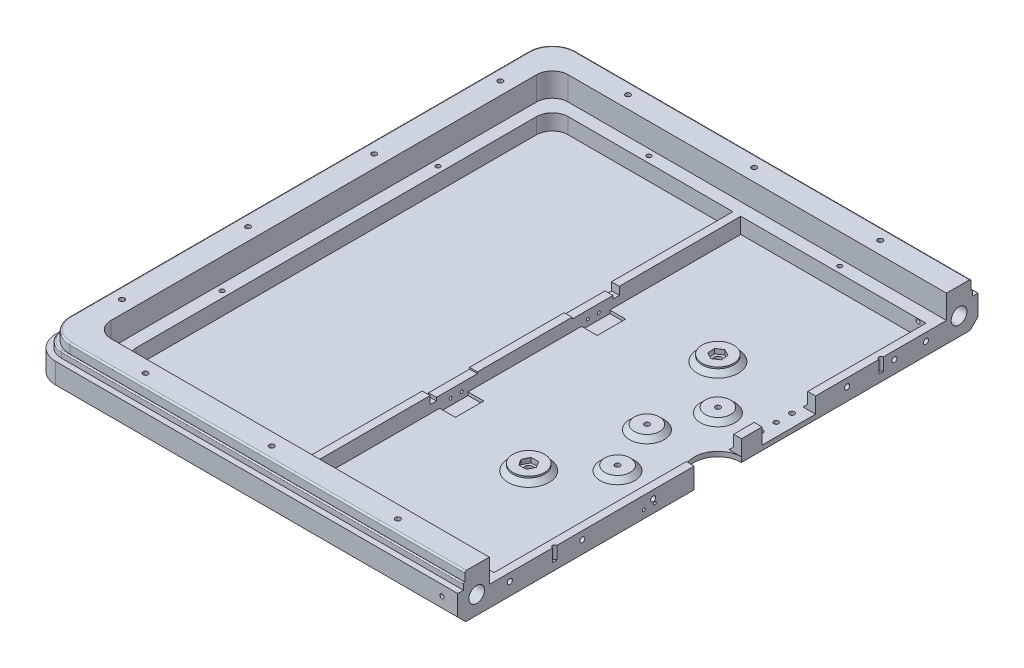
from build123d import *

# Parameters (mm, degrees)
SKETCH1_W                       = 540
SKETCH1_H                       = 330
BOSS_EXTRUDE1_DEPTH             = 3
SKETCH2_W                       = 540
SKETCH2_H                       = 330
SKETCH2_W_2                     = 500
SKETCH2_H_2                     = 290
BOSS_EXTRUDE2_DEPTH             = 25
FILLET1_R                       = 15
SKETCH4_R                       = 1.6
CUT_EXTRUDE1_DEPTH              = 28
SKETCH5_R                       = 15
CUT_EXTRUDE2_DEPTH              = 3
CHAMFER1_SIZE                   = 5
SKETCH7_R                       = 2.6
CUT_EXTRUDE3_DEPTH              = 3
SKETCH9_R                       = 1.6
CUT_EXTRUDE4_DEPTH              = 47
CUT_EXTRUDE5_DEPTH              = 10
FILLET2_R                       = 1
BOSS_EXTRUDE3_DEPTH             = 4
FILLET4_R                       = 0.8
SKETCH23_W                      = 10
SKETCH23_H                      = 130
SKETCH23_W_2                    = 5
SKETCH23_H_2                    = 290
BOSS_EXTRUDE4_DEPTH             = 10
SKETCH24_W                      = 500
SKETCH24_H                      = 290
SKETCH24_W_2                    = 484
SKETCH24_H_2                    = 274
BOSS_EXTRUDE5_DEPTH             = 10
CUT_EXTRUDE6_REACH              = 433.295
SKETCH25_R                      = 0.9
SKETCH26_W                      = 10
SKETCH26_H                      = 18
CUT_EXTRUDE7_DEPTH              = 2
SKETCH27_W                      = 5
SKETCH27_H                      = 30
CUT_EXTRUDE8_DEPTH              = 3
SKETCH28_W                      = 5
SKETCH28_H                      = 60
CUT_EXTRUDE9_DEPTH              = 2
SKETCH29_W                      = 5
SKETCH29_H                      = 4
CUT_EXTRUDE10_DEPTH             = 2
SKETCH31_W                      = 16
SKETCH31_H                      = 34
BOSS_EXTRUDE6_DEPTH             = 53
BOSS_EXTRUDE6_DIRECTION_2_REACH = 318.781
FILLET5_R                       = 15
SKETCH34_R                      = 3
CUT_EXTRUDE11_DEPTH             = 53
SKETCH35_R                      = 8
SKETCH35_R_2                    = 1.6
BOSS_EXTRUDE7_DEPTH             = 3
CHAMFER2_SIZE                   = 3
SKETCH37_W                      = 16
SKETCH37_H                      = 34
CUT_EXTRUDE12_DEPTH             = 63
SKETCH38_R                      = 1.6
SKETCH38_R_2                    = 1.5
CUT_EXTRUDE13_DEPTH             = 90
CHAMFER3_SIZE                   = 3
SKETCH39_R                      = 1.4
CUT_EXTRUDE14_DEPTH             = 8
FILLET6_R                       = 10
FILLET7_R                       = 10
CUT_EXTRUDE15_DEPTH             = 30
CUT_EXTRUDE15_DEPTH_BACK        = 30
SKETCH41_R                      = 5
CUT_EXTRUDE16_DEPTH             = 10
CUT_EXTRUDE16_DEPTH_BACK        = 30
SKETCH42_R                      = 1.6
CUT_EXTRUDE17_DEPTH             = 17
CUT_EXTRUDE17_DEPTH_BACK        = 2
SKETCH45_R                      = 10
SKETCH45_R_2                    = 2.6
BOSS_EXTRUDE8_DEPTH             = 4
CHAMFER4_SIZE                   = 3
CUT_EXTRUDE18_DEPTH             = 3
CUT_EXTRUDE20_REACH             = 429.298
SKETCH52_R                      = 1.35
CUT_EXTRUDE21_REACH             = 319.662
SKETCH51_W                      = 369.751522886
SKETCH51_H                      = 368.591490559


# Some blends are built 0.0001 mm under size
with BuildPart() as part:
    # Sketch1 → Boss-Extrude1 (new body)
    with BuildSketch(Plane(origin=(0, 0, 0), x_dir=(1, 0, 0), z_dir=(0, 1, 0))):
        Rectangle(SKETCH1_W, SKETCH1_H)
    extrude(amount=BOSS_EXTRUDE1_DEPTH)

    # Sketch2 → Boss-Extrude2 (add)
    with BuildSketch(Plane(origin=(0, 3, 0), x_dir=(1, 0, 0), z_dir=(0, 1, 0))):
        Rectangle(SKETCH2_W, SKETCH2_H)
        Rectangle(SKETCH2_W_2, SKETCH2_H_2, mode=Mode.SUBTRACT)
    extrude(amount=BOSS_EXTRUDE2_DEPTH)

    # Fillet1
    fillet1_edges = [part.edges().sort_by_distance(p)[0] for p in [
        (270, 14, 165),
        (-270, 14, 165),
        (-270, 14, -165),
        (270, 14, -165),
    ]]
    fillet(fillet1_edges, radius=FILLET1_R)

    # Sketch4 → Cut-Extrude1 (cut)
    with BuildSketch(Plane(origin=(0, 28, 0), x_dir=(1, 0, 0), z_dir=(0, 1, 0))):
        with Locations(Location((-258, 120, 0), (0, 0, 270))):
            Circle(SKETCH4_R)
        with Locations(Location((-258, 40, 0), (0, 0, 270))):
            Circle(SKETCH4_R)
        with Locations(Location((-210, 153, 0), (0, 0, 270))):
            Circle(SKETCH4_R)
        with Locations(Location((-130, 153, 0), (0, 0, 270))):
            Circle(SKETCH4_R)
        with Locations(Location((-50, 153, 0), (0, 0, 270))):
            Circle(SKETCH4_R)
        with Locations(Location((50, 153, 0), (0, 0, 90))):
            Circle(SKETCH4_R)
        with Locations(Location((130, 153, 0), (0, 0, 90))):
            Circle(SKETCH4_R)
        with Locations(Location((210, 153, 0), (0, 0, 90))):
            Circle(SKETCH4_R)
        with Locations(Location((258, 40, 0), (0, 0, 90))):
            Circle(SKETCH4_R)
        with Locations(Location((258, 120, 0), (0, 0, 90))):
            Circle(SKETCH4_R)
        with Locations(Location((258, -120, 0), (0, 0, 270))):
            Circle(SKETCH4_R)
        with Locations(Location((258, -40, 0), (0, 0, 270))):
            Circle(SKETCH4_R)
        with Locations(Location((210, -153, 0), (0, 0, 270))):
            Circle(SKETCH4_R)
        with Locations(Location((130, -153, 0), (0, 0, 270))):
            Circle(SKETCH4_R)
        with Locations(Location((50, -153, 0), (0, 0, 270))):
            Circle(SKETCH4_R)
        with Locations(Location((-50, -153, 0), (0, 0, 90))):
            Circle(SKETCH4_R)
        with Locations(Location((-130, -153, 0), (0, 0, 90))):
            Circle(SKETCH4_R)
        with Locations(Location((-210, -153, 0), (0, 0, 90))):
            Circle(SKETCH4_R)
        with Locations(Location((-258, -40, 0), (0, 0, 90))):
            Circle(SKETCH4_R)
        with Locations(Location((-258, -120, 0), (0, 0, 90))):
            Circle(SKETCH4_R)
    extrude(amount=-CUT_EXTRUDE1_DEPTH, mode=Mode.SUBTRACT)

    # Sketch5 → Cut-Extrude2 (cut)
    with BuildSketch(Plane(origin=(0, 3, 0), x_dir=(1, 0, 0), z_dir=(0, 1, 0))):
        with Locations(Location((0, 0, 0), (0, 0, 270))):
            Circle(SKETCH5_R)
    extrude(amount=-CUT_EXTRUDE2_DEPTH, mode=Mode.SUBTRACT)

    # Chamfer1
    chamfer1_edges = [part.edges().sort_by_distance(p)[0] for p in [
        (-270, 0, 0),
        (270, 0, 0),
        (0, 0, 165),
        (0, 0, -165),
        (265.606601718, 0, -160.606601718),
        (265.606601718, 0, 160.606601718),
        (-265.606601718, 0, 160.606601718),
        (-265.606601718, 0, -160.606601718),
    ]]
    chamfer(chamfer1_edges, length=CHAMFER1_SIZE)

    # Sketch7 → Cut-Extrude3 (cut)
    with BuildSketch(Plane.XZ):
        with Locations(Location((-60, 60, 0), (0, 0, 270))):
            Circle(SKETCH7_R)
        with Locations(Location((60, 60, 0), (0, 0, 270))):
            Circle(SKETCH7_R)
        with Locations(Location((60, -60, 0), (0, 0, 270))):
            Circle(SKETCH7_R)
        with Locations(Location((-60, -60, 0), (0, 0, 270))):
            Circle(SKETCH7_R)
    extrude(amount=-CUT_EXTRUDE3_DEPTH, mode=Mode.SUBTRACT)

    # Sketch9 → Cut-Extrude4 (cut)
    with BuildSketch(Plane.XZ):
        with Locations(Location((-31.819805153, 31.819805153, 0), (0, 0, 270))):
            Circle(SKETCH9_R)
        with Locations(Location((31.819805153, 31.819805153, 0), (0, 0, 270))):
            Circle(SKETCH9_R)
        with Locations(Location((31.819805153, -31.819805153, 0), (0, 0, 270))):
            Circle(SKETCH9_R)
        with Locations(Location((-31.819805153, -31.819805153, 0), (0, 0, 270))):
            Circle(SKETCH9_R)
        with Locations(Location((45, 0, 0), (0, 0, 270))):
            Circle(SKETCH9_R)
        with Locations(Location((-45, 0, 0), (0, 0, 270))):
            Circle(SKETCH9_R)
    extrude(amount=-CUT_EXTRUDE4_DEPTH, mode=Mode.SUBTRACT)

    # Sketch19 → Cut-Extrude5 (cut)
    with BuildSketch(Plane(origin=(0, 28, 0), x_dir=(1, 0, 0), z_dir=(0, 1, 0))):
        with BuildLine():
            Line((255, -165), (-255, -165))
            ThreePointArc((-255, -165), (-265.606601718, -160.606601718), (-270, -150))
            Line((-270, -150), (-270, 150))
            ThreePointArc((-270, 150), (-265.606601718, 160.606601718), (-255, 165))
            Line((-255, 165), (255, 165))
            ThreePointArc((255, 165), (265.606601718, 160.606601718), (270, 150))
            Line((270, 150), (270, -150))
            ThreePointArc((270, -150), (265.606601718, -160.606601718), (255, -165))
        make_face()
        with BuildLine():
            Line((250.5, 160.5), (-250.5, 160.5))
            ThreePointArc((-250.5, 160.5), (-261.106601718, 156.106601718), (-265.5, 145.5))
            Line((-265.5, 145.5), (-265.5, -145.5))
            ThreePointArc((-265.5, -145.5), (-261.106601718, -156.106601718), (-250.5, -160.5))
            Line((-250.5, -160.5), (250.5, -160.5))
            ThreePointArc((250.5, -160.5), (261.106601718, -156.106601718), (265.5, -145.5))
            Line((265.5, -145.5), (265.5, 145.5))
            ThreePointArc((265.5, 145.5), (261.106601718, 156.106601718), (250.5, 160.5))
        make_face(mode=Mode.SUBTRACT)
    extrude(amount=-CUT_EXTRUDE5_DEPTH, mode=Mode.SUBTRACT)

    # Fillet2
    fillet2_edges = [part.edges().sort_by_distance(p)[0] for p in [
        (-261.106601718, 28, -156.106601718),
        (0, 28, -160.5),
        (261.106601718, 28, -156.106601718),
        (265.5, 28, 0),
        (261.106601718, 28, 156.106601718),
        (0, 28, 160.5),
        (-261.106601718, 28, 156.106601718),
        (-265.5, 28, 0),
    ]]
    fillet(fillet2_edges, radius=FILLET2_R)

    # Sketch20 → Boss-Extrude3 (add)
    with BuildSketch(Plane(origin=(0, 18, 0), x_dir=(1, 0, 0), z_dir=(0, 1, 0))):
        with BuildLine():
            Line((-255, 161.4), (255, 161.4))
            ThreePointArc((255, 161.4), (263.061017306, 158.061017306), (266.4, 150))
            Line((266.4, 150), (266.4, -150))
            ThreePointArc((266.4, -150), (263.061017306, -158.061017306), (255, -161.4))
            Line((255, -161.4), (-255, -161.4))
            ThreePointArc((-255, -161.4), (-263.061017306, -158.061017306), (-266.4, -150))
            Line((-266.4, -150), (-266.4, 150))
            ThreePointArc((-266.4, 150), (-263.061017306, 158.061017306), (-255, 161.4))
        make_face()
        with BuildLine():
            Line((-255, 157.9), (255, 157.9))
            ThreePointArc((255, 157.9), (260.586143571, 155.586143571), (262.9, 150))
            Line((262.9, 150), (262.9, -150))
            ThreePointArc((262.9, -150), (260.586143571, -155.586143571), (255, -157.9))
            Line((255, -157.9), (-255, -157.9))
            ThreePointArc((-255, -157.9), (-260.586143571, -155.586143571), (-262.9, -150))
            Line((-262.9, -150), (-262.9, 150))
            ThreePointArc((-262.9, 150), (-260.586143571, 155.586143571), (-255, 157.9))
        make_face(mode=Mode.SUBTRACT)
    extrude(amount=BOSS_EXTRUDE3_DEPTH)

    # Fillet4
    fillet4_edges = [part.edges().sort_by_distance(p)[0] for p in [
        (-263.061017306, 22, -158.061017306),
        (-266.4, 22, 0),
        (-263.061017306, 22, 158.061017306),
        (0, 22, 161.4),
        (263.061017306, 22, 158.061017306),
        (266.4, 22, 0),
        (263.061017306, 22, -158.061017306),
        (0, 22, -161.4),
    ]]
    fillet(fillet4_edges, radius=FILLET4_R)

    # Sketch23 → Boss-Extrude4 (add)
    with BuildSketch(Plane(origin=(0, 3, 0), x_dir=(1, 0, 0), z_dir=(0, 1, 0))):
        with Locations((0, 80)):
            Rectangle(SKETCH23_W, SKETCH23_H)
        with Locations((0, -80)):
            Rectangle(SKETCH23_W, SKETCH23_H)
        with Locations((125, 0)):
            Rectangle(SKETCH23_W_2, SKETCH23_H_2)
        with Locations((-125, 0)):
            Rectangle(SKETCH23_W_2, SKETCH23_H_2)
    extrude(amount=BOSS_EXTRUDE4_DEPTH)

    # Sketch24 → Boss-Extrude5 (add)
    with BuildSketch(Plane(origin=(0, 3, 0), x_dir=(1, 0, 0), z_dir=(0, 1, 0))):
        Rectangle(SKETCH24_W, SKETCH24_H)
        Rectangle(SKETCH24_W_2, SKETCH24_H_2, mode=Mode.SUBTRACT)
    extrude(amount=BOSS_EXTRUDE5_DEPTH)

    # Cut-Extrude6: up to this face of the body (flat: up to its plane)
    cut_extrude6_end = Plane(part.part.faces().sort_by_distance((-127.5, 8, 0))[0])
    # Sketch25 → Cut-Extrude6 (cut, up to the picked face)
    with BuildSketch(Plane(origin=(127.5, 0, 0), x_dir=(0, 0, -1), z_dir=(1, 0, 0)), mode=Mode.PRIVATE) as cut_extrude6_sk1:
        with Locations(Location((-47, 5, 0), (0, 0, 180))):
            Circle(SKETCH25_R)
    cut_extrude6_tool1 = split(extrude(cut_extrude6_sk1.sketch, amount=-CUT_EXTRUDE6_REACH, mode=Mode.PRIVATE), bisect_by=cut_extrude6_end, keep=Keep.BOTH, mode=Mode.PRIVATE)
    # Sketch25 → Cut-Extrude6 (cut, up to the picked face)
    with BuildSketch(Plane(origin=(127.5, 0, 0), x_dir=(0, 0, -1), z_dir=(1, 0, 0)), mode=Mode.PRIVATE) as cut_extrude6_sk2:
        with Locations(Location((-40, 5, 0), (0, 0, 180))):
            Circle(SKETCH25_R)
    cut_extrude6_tool2 = split(extrude(cut_extrude6_sk2.sketch, amount=-CUT_EXTRUDE6_REACH, mode=Mode.PRIVATE), bisect_by=cut_extrude6_end, keep=Keep.BOTH, mode=Mode.PRIVATE)
    # Sketch25 → Cut-Extrude6 (cut, up to the picked face)
    with BuildSketch(Plane(origin=(127.5, 0, 0), x_dir=(0, 0, -1), z_dir=(1, 0, 0)), mode=Mode.PRIVATE) as cut_extrude6_sk3:
        with Locations(Location((47, 5, 0), (0, 0, 180))):
            Circle(SKETCH25_R)
    cut_extrude6_tool3 = split(extrude(cut_extrude6_sk3.sketch, amount=-CUT_EXTRUDE6_REACH, mode=Mode.PRIVATE), bisect_by=cut_extrude6_end, keep=Keep.BOTH, mode=Mode.PRIVATE)
    # Sketch25 → Cut-Extrude6 (cut, up to the picked face)
    with BuildSketch(Plane(origin=(127.5, 0, 0), x_dir=(0, 0, -1), z_dir=(1, 0, 0)), mode=Mode.PRIVATE) as cut_extrude6_sk4:
        with Locations(Location((40, 5, 0), (0, 0, 180))):
            Circle(SKETCH25_R)
    cut_extrude6_tool4 = split(extrude(cut_extrude6_sk4.sketch, amount=-CUT_EXTRUDE6_REACH, mode=Mode.PRIVATE), bisect_by=cut_extrude6_end, keep=Keep.BOTH, mode=Mode.PRIVATE)
    add(cut_extrude6_tool1.solids().sort_by(Axis((127.5, 5, 47), (-1, 0, 0)))[0], mode=Mode.SUBTRACT)
    add(cut_extrude6_tool2.solids().sort_by(Axis((127.5, 5, 40), (-1, 0, 0)))[0], mode=Mode.SUBTRACT)
    add(cut_extrude6_tool3.solids().sort_by(Axis((127.5, 5, -47), (-1, 0, 0)))[0], mode=Mode.SUBTRACT)
    add(cut_extrude6_tool4.solids().sort_by(Axis((127.5, 5, -40), (-1, 0, 0)))[0], mode=Mode.SUBTRACT)

    # Sketch26 → Cut-Extrude7 (cut)
    with BuildSketch(Plane(origin=(0, 3, 0), x_dir=(1, 0, 0), z_dir=(0, 1, 0))):
        with Locations((-117.5, -45)):
            Rectangle(SKETCH26_W, SKETCH26_H)
        with Locations((-117.5, 45)):
            Rectangle(SKETCH26_W, SKETCH26_H)
        with Locations((117.5, -45)):
            Rectangle(SKETCH26_W, SKETCH26_H)
        with Locations((117.5, 45)):
            Rectangle(SKETCH26_W, SKETCH26_H)
    extrude(amount=-CUT_EXTRUDE7_DEPTH, mode=Mode.SUBTRACT)

    # Sketch27 → Cut-Extrude8 (cut)
    with BuildSketch(Plane(origin=(0, 13, 0), x_dir=(1, 0, 0), z_dir=(0, 1, 0))):
        with Locations((-125, -45)):
            Rectangle(SKETCH27_W, SKETCH27_H)
        with Locations((-125, 45)):
            Rectangle(SKETCH27_W, SKETCH27_H)
        with Locations((125, 45)):
            Rectangle(SKETCH27_W, SKETCH27_H)
        with Locations((125, -45)):
            Rectangle(SKETCH27_W, SKETCH27_H)
    extrude(amount=-CUT_EXTRUDE8_DEPTH, mode=Mode.SUBTRACT)

    # Sketch28 → Cut-Extrude9 (cut)
    with BuildSketch(Plane(origin=(0, 13, 0), x_dir=(1, 0, 0), z_dir=(0, 1, 0))):
        with Locations((-125, 0)):
            Rectangle(SKETCH28_W, SKETCH28_H)
        with Locations((125, 0)):
            Rectangle(SKETCH28_W, SKETCH28_H)
    extrude(amount=-CUT_EXTRUDE9_DEPTH, mode=Mode.SUBTRACT)

    # Sketch29 → Cut-Extrude10 (cut)
    with BuildSketch(Plane(origin=(0, 10, 0), x_dir=(1, 0, 0), z_dir=(0, 1, 0))):
        with Locations((-125, 58)):
            Rectangle(SKETCH29_W, SKETCH29_H)
        with Locations((-125, -58)):
            Rectangle(SKETCH29_W, SKETCH29_H)
        with Locations((125, -58)):
            Rectangle(SKETCH29_W, SKETCH29_H)
        with Locations((125, 58)):
            Rectangle(SKETCH29_W, SKETCH29_H)
    extrude(amount=-CUT_EXTRUDE10_DEPTH, mode=Mode.SUBTRACT)

    # Sketch31 → Boss-Extrude6 (add)
    with BuildSketch(Plane(origin=(0, 13, 0), x_dir=(1, 0, 0), z_dir=(0, 1, 0))):
        with Locations((0, 45)):
            Rectangle(SKETCH31_W, SKETCH31_H)
    extrude(amount=BOSS_EXTRUDE6_DEPTH)

    # Boss-Extrude6 direction 2: up to this face of the body (flat: up to its plane)
    boss_extrude6_direction_2_end = Plane(part.part.faces().sort_by_distance((-63.514526325, 3, 0))[0])
    # Sketch31 → Boss-Extrude6 direction 2 (add, up to the picked face)
    with BuildSketch(Plane(origin=(0, 13, 0), x_dir=(1, 0, 0), z_dir=(0, 1, 0)), mode=Mode.PRIVATE) as boss_extrude6_direction_2_sk1:
        with Locations((0, 45)):
            Rectangle(SKETCH31_W, SKETCH31_H)
    boss_extrude6_direction_2_tool1 = split(extrude(boss_extrude6_direction_2_sk1.sketch, amount=-BOSS_EXTRUDE6_DIRECTION_2_REACH, mode=Mode.PRIVATE), bisect_by=boss_extrude6_direction_2_end, keep=Keep.BOTH, mode=Mode.PRIVATE)
    add(boss_extrude6_direction_2_tool1.solids().sort_by(Axis((0, 13, -45), (0, -1, 0)))[0])

    # Fillet5
    fillet5_edges = [part.edges().sort_by_distance(p)[0] for p in [
        (0, 66, -62),
        (0, 66, -28),
    ]]
    fillet(fillet5_edges, radius=FILLET5_R)

    # Sketch34 → Cut-Extrude11 (cut)
    with BuildSketch(Plane.ZY.offset(8)):
        with Locations((-45, 53)):
            Circle(SKETCH34_R)
    extrude(amount=-CUT_EXTRUDE11_DEPTH, mode=Mode.SUBTRACT)

    # Sketch35 → Boss-Extrude7 (add)
    # profile 1 of 6: a face of its own
    with BuildSketch(Plane(origin=(0, 3, 0), x_dir=(1, 0, 0), z_dir=(0, 1, 0))):
        with Locations(Location((-31.819805153, 31.819805153, 0), (0, 0, 90))):
            Circle(SKETCH35_R)
        with Locations(Location((-31.819805153, 31.819805153, 0), (0, 0, 90))):
            Circle(SKETCH35_R_2, mode=Mode.SUBTRACT)
    # profile 2 of 6: a face of its own
    with BuildSketch(Plane(origin=(0, 3, 0), x_dir=(1, 0, 0), z_dir=(0, 1, 0))):
        with Locations(Location((31.819805153, 31.819805153, 0), (0, 0, 90))):
            Circle(SKETCH35_R)
        with Locations(Location((31.819805153, 31.819805153, 0), (0, 0, 90))):
            Circle(SKETCH35_R_2, mode=Mode.SUBTRACT)
    # profile 3 of 6: a face of its own
    with BuildSketch(Plane(origin=(0, 3, 0), x_dir=(1, 0, 0), z_dir=(0, 1, 0))):
        with Locations(Location((31.819805153, -31.819805153, 0), (0, 0, 90))):
            Circle(SKETCH35_R)
        with Locations(Location((31.819805153, -31.819805153, 0), (0, 0, 90))):
            Circle(SKETCH35_R_2, mode=Mode.SUBTRACT)
    # profile 4 of 6: a face of its own
    with BuildSketch(Plane(origin=(0, 3, 0), x_dir=(1, 0, 0), z_dir=(0, 1, 0))):
        with Locations(Location((-31.819805153, -31.819805153, 0), (0, 0, 90))):
            Circle(SKETCH35_R)
        with Locations(Location((-31.819805153, -31.819805153, 0), (0, 0, 90))):
            Circle(SKETCH35_R_2, mode=Mode.SUBTRACT)
    # profile 5 of 6: a face of its own
    with BuildSketch(Plane(origin=(0, 3, 0), x_dir=(1, 0, 0), z_dir=(0, 1, 0))):
        with Locations(Location((-45, 0, 0), (0, 0, 90))):
            Circle(SKETCH35_R)
        with Locations(Location((-45, 0, 0), (0, 0, 270))):
            Circle(SKETCH35_R_2, mode=Mode.SUBTRACT)
    # profile 6 of 6: a face of its own
    with BuildSketch(Plane(origin=(0, 3, 0), x_dir=(1, 0, 0), z_dir=(0, 1, 0))):
        with Locations(Location((45, 0, 0), (0, 0, 90))):
            Circle(SKETCH35_R)
        with Locations(Location((45, 0, 0), (0, 0, 90))):
            Circle(SKETCH35_R_2, mode=Mode.SUBTRACT)
    extrude(amount=BOSS_EXTRUDE7_DEPTH)

    # Chamfer2
    chamfer2_edges = [part.edges().sort_by_distance(p)[0] for p in [
        (-31.819805153, 3, -23.819805153),
        (-45, 3, 8),
        (31.819805153, 3, -23.819805153),
        (31.819805153, 3, 39.819805153),
        (-31.819805153, 3, 39.819805153),
        (45, 3, 8),
    ]]
    chamfer(chamfer2_edges, length=CHAMFER2_SIZE - 0.0001)  # a hair under: the kernel refuses the full size

    # Sketch37 → Cut-Extrude12 (cut)
    with BuildSketch(Plane(origin=(0, 66, 0), x_dir=(1, 0, 0), z_dir=(0, 1, 0))):
        with Locations((0, 45)):
            Rectangle(SKETCH37_W, SKETCH37_H)
    extrude(amount=-CUT_EXTRUDE12_DEPTH, mode=Mode.SUBTRACT)

    # Sketch38 → Cut-Extrude13 (cut)
    with BuildSketch(Plane(origin=(0, 3, 0), x_dir=(1, 0, 0), z_dir=(0, 1, 0))):
        with Locations(Location((8, 55, 0), (0, 0, 270))):
            Circle(SKETCH38_R)
        with Locations(Location((8, 35, 0), (0, 0, 270))):
            Circle(SKETCH38_R)
        with Locations(Location((-8, 35, 0), (0, 0, 270))):
            Circle(SKETCH38_R)
        with Locations(Location((-8, 55, 0), (0, 0, 270))):
            Circle(SKETCH38_R)
        with Locations(Location((8, 45, 0), (0, 0, 270))):
            Circle(SKETCH38_R_2)
        with Locations(Location((-8, 45, 0), (0, 0, 270))):
            Circle(SKETCH38_R_2)
    extrude(amount=-CUT_EXTRUDE13_DEPTH, mode=Mode.SUBTRACT)

    # Chamfer3
    # the kernel refuses this chamfer: 3 mm, written as the material it adds along each edge
    with BuildSketch(Plane(origin=(5, 3, -15), x_dir=(0.9996219169112969, -0.027495876610586348, 0), z_dir=(0, 0, -1)), Plane(origin=(-5, 3, -28), x_dir=(-0.9996219169112968, -0.027495876610586358, 0), z_dir=(0, 0, 1))) as chamfer3_piece_1:
        Polygon((CHAMFER3_SIZE * 0.999621916911, -CHAMFER3_SIZE * 0.0274958766106), (-CHAMFER3_SIZE * 0.0274958766106, -CHAMFER3_SIZE * 0.999621916911), (0, 0), align=None)
    extrude(amount=13)
    with BuildSketch(Plane(origin=(5, 3, 144.715048964), x_dir=(0.9996219169112969, -0.027495876610586348, 0), z_dir=(0, 0, -1))) as chamfer3_piece_2_section:
        Polygon((CHAMFER3_SIZE * 0.999621916911, -CHAMFER3_SIZE * 0.0274958766106), (-CHAMFER3_SIZE * 0.0274958766106, -CHAMFER3_SIZE * 0.999621916911), (0, 0), align=None)
    chamfer3_piece_2 = extrude(amount=129.715048964, mode=Mode.PRIVATE)
    chamfer3_piece_2 = chamfer3_piece_2 - Plane(origin=(5.98938088, 5, 47), x_dir=(0, 0, 1), z_dir=(1, 0, 0)) * Cylinder(0.9, 272, mode=Mode.PRIVATE)
    chamfer3_piece_2 = chamfer3_piece_2 - Plane(origin=(5.98938088, 5, 40), x_dir=(0, 0, 1), z_dir=(1, 0, 0)) * Cylinder(0.9, 272, mode=Mode.PRIVATE)
    add(chamfer3_piece_2)
    with BuildSketch(Plane(origin=(-5, 3, 15), x_dir=(-0.9996219169112968, -0.027495876610586358, 0), z_dir=(0, 0, 1))) as chamfer3_piece_3_section:
        Polygon((CHAMFER3_SIZE * 0.999621916911, -CHAMFER3_SIZE * 0.0274958766106), (-CHAMFER3_SIZE * 0.0274958766106, -CHAMFER3_SIZE * 0.999621916911), (0, 0), align=None)
    chamfer3_piece_3 = extrude(amount=129.715048964, mode=Mode.PRIVATE)
    chamfer3_piece_3 = chamfer3_piece_3 - Plane(origin=(-5.993381488, 5, 47), x_dir=(0, 0, 1), z_dir=(1, 0, 0)) * Cylinder(0.9, 272, mode=Mode.PRIVATE)
    chamfer3_piece_3 = chamfer3_piece_3 - Plane(origin=(-5.993381488, 5, 40), x_dir=(0, 0, 1), z_dir=(1, 0, 0)) * Cylinder(0.9, 272, mode=Mode.PRIVATE)
    add(chamfer3_piece_3)
    with BuildSketch(Plane(origin=(5, 3, -62), x_dir=(0.9996219169112969, -0.027495876610586348, 0), z_dir=(0, 0, -1)), Plane(origin=(-5, 3, -144.715048964), x_dir=(-0.9996219169112968, -0.027495876610586358, 0), z_dir=(0, 0, 1))) as chamfer3_piece_4:
        Polygon((CHAMFER3_SIZE * 0.999621916911, -CHAMFER3_SIZE * 0.0274958766106), (-CHAMFER3_SIZE * 0.0274958766106, -CHAMFER3_SIZE * 0.999621916911), (0, 0), align=None)
    extrude(amount=82.715048964)

    # Sketch39 → Cut-Extrude14 (cut)
    with BuildSketch(Plane(origin=(0, 13, 0), x_dir=(1, 0, 0), z_dir=(0, 1, 0))):
        with Locations(Location((-246, 68.5, 0), (0, 0, 270))):
            Circle(SKETCH39_R)
        with Locations(Location((-184.75, 141, 0), (0, 0, 270))):
            Circle(SKETCH39_R)
        with Locations(Location((-63.75, 141, 0), (0, 0, 270))):
            Circle(SKETCH39_R)
        with Locations(Location((63.75, 141, 0), (0, 0, 90))):
            Circle(SKETCH39_R)
        with Locations(Location((184.75, 141, 0), (0, 0, 90))):
            Circle(SKETCH39_R)
        with Locations(Location((246, 68.5, 0), (0, 0, 90))):
            Circle(SKETCH39_R)
        with Locations(Location((0, 103.5, 0), (0, 0, 270))):
            Circle(SKETCH39_R)
        with Locations(Location((0, -103.5, 0), (0, 0, 90))):
            Circle(SKETCH39_R)
        with Locations(Location((246, -68.5, 0), (0, 0, 270))):
            Circle(SKETCH39_R)
        with Locations(Location((184.75, -141, 0), (0, 0, 270))):
            Circle(SKETCH39_R)
        with Locations(Location((63.75, -141, 0), (0, 0, 270))):
            Circle(SKETCH39_R)
        with Locations(Location((-63.75, -141, 0), (0, 0, 90))):
            Circle(SKETCH39_R)
        with Locations(Location((-184.75, -141, 0), (0, 0, 90))):
            Circle(SKETCH39_R)
        with Locations(Location((-246, -68.5, 0), (0, 0, 90))):
            Circle(SKETCH39_R)
    extrude(amount=-CUT_EXTRUDE14_DEPTH, mode=Mode.SUBTRACT)

    # Fillet6
    fillet6_edges = [part.edges().sort_by_distance(p)[0] for p in [
        (242, 8, 137),
        (-242, 8, -137),
        (242, 8, -137),
        (-242, 8, 137),
    ]]
    fillet(fillet6_edges, radius=FILLET6_R)

    # Fillet7
    fillet7_edges = [part.edges().sort_by_distance(p)[0] for p in [
        (250, 20.5, -145),
        (-250, 20.5, -145),
        (-250, 20.5, 145),
        (250, 20.5, 145),
    ]]
    fillet(fillet7_edges, radius=FILLET7_R)

    # Sketch41 → Cut-Extrude15 (cut, two sides: drawn at the far end of the back side and taken through both)
    with BuildSketch(Plane(origin=(0, 0, 0), x_dir=(0, 0, -1), z_dir=(1, 0, 0)).offset(-CUT_EXTRUDE15_DEPTH_BACK)):
        with Locations((153, 11.5)):
            Circle(SKETCH41_R)
        with Locations(Location((-153, 11.5, 0), (0, 0, 180))):
            Circle(SKETCH41_R)
    extrude(amount=CUT_EXTRUDE15_DEPTH + CUT_EXTRUDE15_DEPTH_BACK, mode=Mode.SUBTRACT)

    # Sketch42 → Cut-Extrude16 (cut, two sides: drawn at the far end of the back side and taken through both)
    with BuildSketch(Plane(origin=(5, 0, 0), x_dir=(0, 0, -1), z_dir=(1, 0, 0)).offset(-CUT_EXTRUDE16_DEPTH_BACK)):
        with Locations(Location((112, 8, 0), (0, 0, 180))):
            Circle(SKETCH42_R)
        with Locations(Location((132, 8, 0), (0, 0, 180))):
            Circle(SKETCH42_R)
        with Locations(Location((82, 8, 0), (0, 0, 180))):
            Circle(SKETCH42_R)
        with Locations(Location((-86, 8, 0), (0, 0, 180))):
            Circle(SKETCH42_R)
        with Locations(Location((-132, 8, 0), (0, 0, 180))):
            Circle(SKETCH42_R)
        with Locations(Location((-41.05, 8, 0), (0, 0, 180))):
            Circle(SKETCH42_R)
    extrude(amount=CUT_EXTRUDE16_DEPTH + CUT_EXTRUDE16_DEPTH_BACK, mode=Mode.SUBTRACT)

    # Sketch43 → Cut-Extrude17 (cut, two sides: drawn at the far end of the back side and taken through both)
    with BuildSketch(Plane(origin=(5, 0, 0), x_dir=(0, 0, -1), z_dir=(1, 0, 0)).offset(-CUT_EXTRUDE17_DEPTH_BACK)):
        Polygon((-87.616580754, 10.8), (-89.233161507, 8), (-87.616580754, 5.2), (-84.383419246, 5.2), (-82.766838493, 8), (-84.383419246, 10.8), align=None)
        Polygon((-128.766838493, 8), (-130.383419246, 10.8), (-133.616580754, 10.8), (-135.233161507, 8), (-133.616580754, 5.2), (-130.383419246, 5.2), align=None)
        Polygon((-37.816838493, 8), (-39.433419246, 10.8), (-42.666580754, 10.8), (-44.283161507, 8), (-42.666580754, 5.2), (-39.433419246, 5.2), align=None)
        Polygon((85.233161507, 8), (83.616580754, 10.8), (80.383419246, 10.8), (78.766838493, 8), (80.383419246, 5.2), (83.616580754, 5.2), align=None)
        Polygon((115.233161507, 8), (113.616580754, 10.8), (110.383419246, 10.8), (108.766838493, 8), (110.383419246, 5.2), (113.616580754, 5.2), align=None)
        Polygon((130.383419246, 10.8), (128.766838493, 8), (130.383419246, 5.2), (133.616580754, 5.2), (135.233161507, 8), (133.616580754, 10.8), align=None)
    extrude(amount=CUT_EXTRUDE17_DEPTH + CUT_EXTRUDE17_DEPTH_BACK, mode=Mode.SUBTRACT)

    # Sketch45 → Boss-Extrude8 (add)
    # profile 1 of 4: a face of its own
    with BuildSketch(Plane(origin=(0, 3, 0), x_dir=(1, 0, 0), z_dir=(0, 1, 0))):
        with Locations(Location((-60, 60, 0), (0, 0, 90))):
            Circle(SKETCH45_R)
        with Locations(Location((-60, 60, 0), (0, 0, 90))):
            Circle(SKETCH45_R_2, mode=Mode.SUBTRACT)
    # profile 2 of 4: a face of its own
    with BuildSketch(Plane(origin=(0, 3, 0), x_dir=(1, 0, 0), z_dir=(0, 1, 0))):
        with Locations(Location((60, 60, 0), (0, 0, 90))):
            Circle(SKETCH45_R)
        with Locations(Location((60, 60, 0), (0, 0, 90))):
            Circle(SKETCH45_R_2, mode=Mode.SUBTRACT)
    # profile 3 of 4: a face of its own
    with BuildSketch(Plane(origin=(0, 3, 0), x_dir=(1, 0, 0), z_dir=(0, 1, 0))):
        with Locations(Location((60, -60, 0), (0, 0, 90))):
            Circle(SKETCH45_R)
        with Locations(Location((60, -60, 0), (0, 0, 90))):
            Circle(SKETCH45_R_2, mode=Mode.SUBTRACT)
    # profile 4 of 4: a face of its own
    with BuildSketch(Plane(origin=(0, 3, 0), x_dir=(1, 0, 0), z_dir=(0, 1, 0))):
        with Locations(Location((-60, -60, 0), (0, 0, 90))):
            Circle(SKETCH45_R)
        with Locations(Location((-60, -60, 0), (0, 0, 90))):
            Circle(SKETCH45_R_2, mode=Mode.SUBTRACT)
    extrude(amount=BOSS_EXTRUDE8_DEPTH)

    # Chamfer4
    chamfer4_edges = [part.edges().sort_by_distance(p)[0] for p in [
        (-60, 3, -50),
        (60, 3, -50),
        (60, 3, 70),
        (-60, 3, 70),
    ]]
    chamfer(chamfer4_edges, length=CHAMFER4_SIZE)

    # Sketch48 → Cut-Extrude18 (cut)
    with BuildSketch(Plane(origin=(0, 7, 0), x_dir=(1, 0, 0), z_dir=(0, 1, 0))):
        Polygon((62.567013443, 56.090979409), (64.668817858, 60.268588558), (62.101804414, 64.177609149), (57.432986557, 63.909020591), (55.331182143, 59.731411442), (57.898195586, 55.822390851), align=None)
        Polygon((-56.090979409, 62.567013443), (-60.268588558, 64.668817857), (-64.177609149, 62.101804414), (-63.909020591, 57.432986557), (-59.731411442, 55.331182143), (-55.822390851, 57.898195586), align=None)
        Polygon((56.090979409, -62.567013443), (60.268588558, -64.668817857), (64.177609149, -62.101804414), (63.909020591, -57.432986557), (59.731411442, -55.331182143), (55.822390851, -57.898195586), align=None)
        Polygon((-62.567013443, -56.090979409), (-64.668817857, -60.268588558), (-62.101804414, -64.177609149), (-57.432986557, -63.909020591), (-55.331182143, -59.731411442), (-57.898195586, -55.822390851), align=None)
    extrude(amount=-CUT_EXTRUDE18_DEPTH, mode=Mode.SUBTRACT)

    # Cut-Extrude20: up to this face of the body (flat: up to its plane)
    cut_extrude20_end = Plane(part.part.faces().sort_by_distance((0, 11.5, -165))[0])
    # Sketch52 → Cut-Extrude20 (cut, up to the picked face)
    with BuildSketch(Plane.XY.offset(165), mode=Mode.PRIVATE) as cut_extrude20_sk1:
        with Locations((-10, 11.5)):
            Circle(SKETCH52_R)
    cut_extrude20_tool1 = split(extrude(cut_extrude20_sk1.sketch, amount=-CUT_EXTRUDE20_REACH, mode=Mode.PRIVATE), bisect_by=cut_extrude20_end, keep=Keep.BOTH, mode=Mode.PRIVATE)
    # Sketch52 → Cut-Extrude20 (cut, up to the picked face)
    with BuildSketch(Plane.XY.offset(165), mode=Mode.PRIVATE) as cut_extrude20_sk2:
        with Locations((10, 11.5)):
            Circle(SKETCH52_R)
    cut_extrude20_tool2 = split(extrude(cut_extrude20_sk2.sketch, amount=-CUT_EXTRUDE20_REACH, mode=Mode.PRIVATE), bisect_by=cut_extrude20_end, keep=Keep.BOTH, mode=Mode.PRIVATE)
    add(cut_extrude20_tool1.solids().sort_by(Axis((-10, 11.5, 165), (0, 0, -1)))[0], mode=Mode.SUBTRACT)
    add(cut_extrude20_tool2.solids().sort_by(Axis((10, 11.5, 165), (0, 0, -1)))[0], mode=Mode.SUBTRACT)

    # Cut-Extrude21: up to this face of the body (flat: up to its plane)
    cut_extrude21_end = Plane(part.part.faces().sort_by_distance((-258.808877323, 0, 0))[0])
    # Sketch51 → Cut-Extrude21 (cut, up to the picked face)
    with BuildSketch(Plane(origin=(0, 28, 0), x_dir=(1, 0, 0), z_dir=(0, 1, 0)), mode=Mode.PRIVATE) as cut_extrude21_sk1:
        with Locations((184.875761443, -19.29574528)):
            Rectangle(SKETCH51_W, SKETCH51_H)
    cut_extrude21_tool1 = split(extrude(cut_extrude21_sk1.sketch, amount=-CUT_EXTRUDE21_REACH, mode=Mode.PRIVATE), bisect_by=cut_extrude21_end, keep=Keep.BOTH, mode=Mode.PRIVATE)
    add(cut_extrude21_tool1.solids().sort_by(Axis((184.875761, 28, 19.295745), (0, -1, 0)))[0], mode=Mode.SUBTRACT)


solid = part.part
